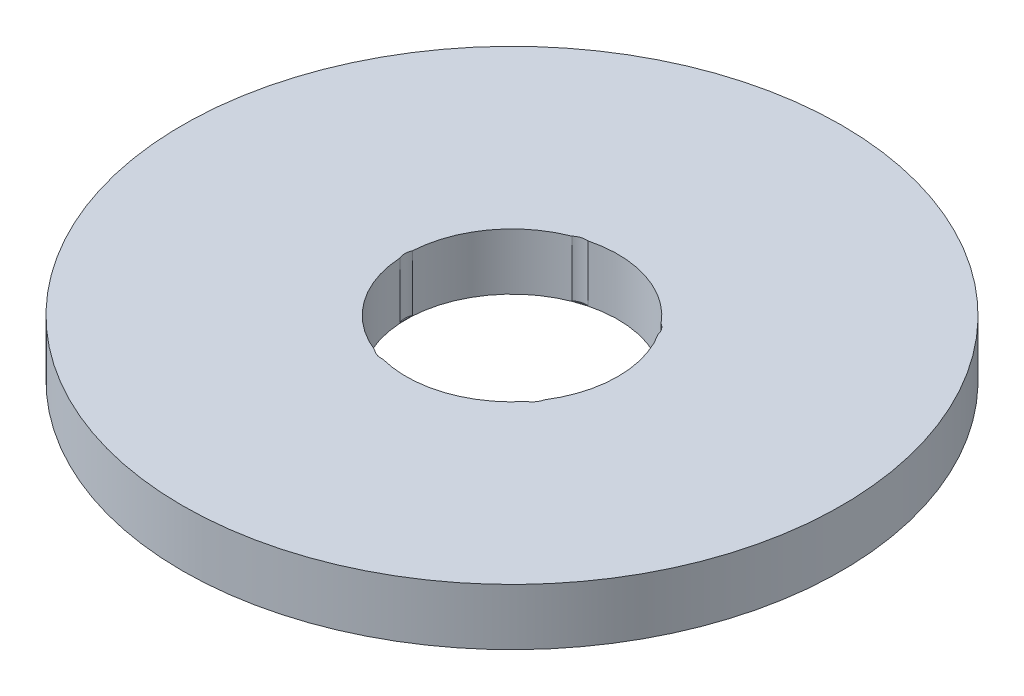
from build123d import *

# Parameters (mm, degrees)
SKETCH1_R           = 70
BOSS_EXTRUDE1_DEPTH = 12
SKETCH2_R           = 22.5
CUT_EXTRUDE1_DEPTH  = 100.719606899
SKETCH3_R           = 3.357023025
CUT_EXTRUDE2_DEPTH  = 11.912906832
CIRPATTERN1_COUNT   = 5


with BuildPart() as part:
    # Sketch1 → Boss-Extrude1 (new body)
    with BuildSketch(Plane(origin=(0, 0, 0), x_dir=(1, 0, 0), z_dir=(0, 1, 0))):
        Circle(SKETCH1_R)
    extrude(amount=BOSS_EXTRUDE1_DEPTH)

    # Sketch2 → Cut-Extrude1 (cut, through all)
    with BuildSketch(Plane(origin=(0, 0, 0), x_dir=(1, 0, 0), z_dir=(0, 1, 0))):
        Circle(SKETCH2_R)
    extrude(amount=CUT_EXTRUDE1_DEPTH, mode=Mode.SUBTRACT)

    # Sketch3 → Cut-Extrude2 (cut)
    with BuildSketch(Plane(origin=(0, 12, 0), x_dir=(1, 0, 0), z_dir=(0, 1, 0))):
        with Locations((-19.385416066, 0)):
            Circle(SKETCH3_R)
    cut_extrude2 = extrude(amount=-CUT_EXTRUDE2_DEPTH, mode=Mode.SUBTRACT)

    # CirPattern1: Cut-Extrude2 ×5 about axis
    cirpattern1_axis = Axis((0, 0, 0), (0, 1, 0))
    for i in range(1, CIRPATTERN1_COUNT):
        add(cut_extrude2.rotate(cirpattern1_axis, i * 360 / CIRPATTERN1_COUNT), mode=Mode.SUBTRACT)


solid = part.part
